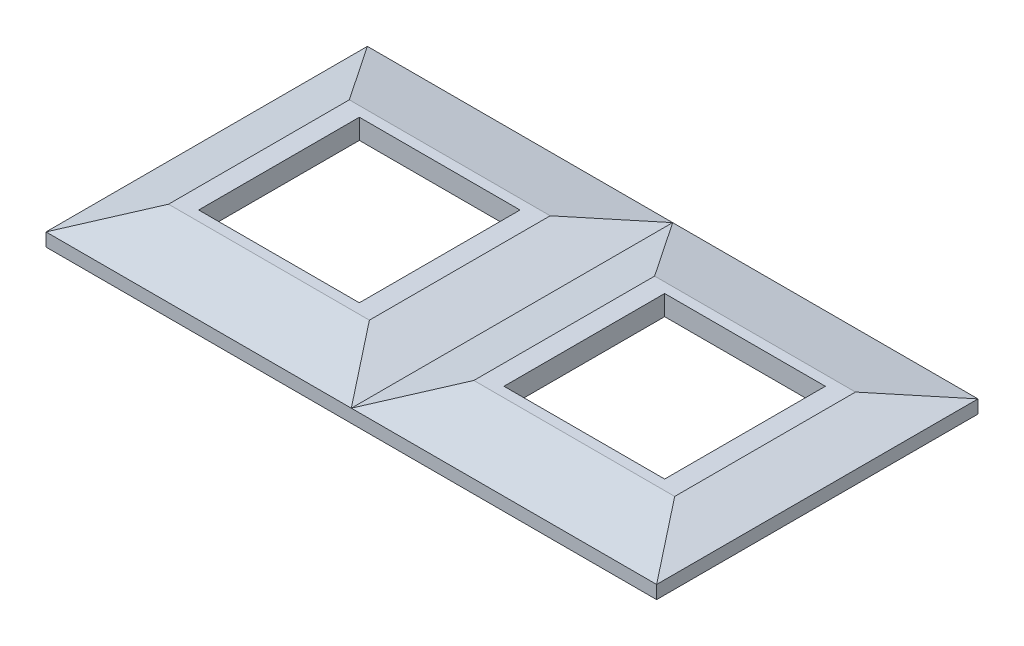
from build123d import *

# Parameters (mm, degrees)
EXTRUDE_1_DEPTH     = 40
SKETCH_2_OUTSIDE_W  = 116.382
SKETCH_2_OUTSIDE_H  = 43.382
CUT_EXTRUDE_1_DEPTH = 78
SKETCH_3_W          = 40
SKETCH_3_H          = 40
CUT_EXTRUDE_2_DEPTH = 87.168439698
SKETCH_4_W          = 71
SKETCH_4_H          = 71
CUT_EXTRUDE_3_DEPTH = 2


with BuildPart() as part:
    # Эскиз1 → Бобышка-Вытянуть1 (new, symmetric)
    with BuildSketch(Plane.XY):
        Polygon((0, 0), (-76, 0), (-76, 3.277823138), (-63, 7), (-13, 7), (0, 3.277823138), (13, 7), (63, 7), (76, 3.277823138), (76, 0), align=None)
    extrude(amount=EXTRUDE_1_DEPTH, both=True)

    # Эскиз2 outside → Вырез-Вытянуть1 (cut, symmetric)
    with BuildSketch(Plane(origin=(0, 0, 0), x_dir=(0, 0, -1), z_dir=(1, 0, 0))):
        with Locations((0, 3.5)):
            Rectangle(SKETCH_2_OUTSIDE_W, SKETCH_2_OUTSIDE_H)
        Polygon((40, 0), (-40, 0), (-40, 3.277823138), (-22.5, 7), (22.5, 7), (40, 3.277823138), align=None, mode=Mode.SUBTRACT)
    extrude(amount=CUT_EXTRUDE_1_DEPTH, both=True, mode=Mode.SUBTRACT)

    # Эскиз3 → Вырез-Вытянуть2 (cut, through all)
    with BuildSketch(Plane.XZ):
        with Locations((-38, 0)):
            Rectangle(SKETCH_3_W, SKETCH_3_H)
        with Locations((38, 0)):
            Rectangle(SKETCH_3_W, SKETCH_3_H)
    extrude(amount=-CUT_EXTRUDE_2_DEPTH, mode=Mode.SUBTRACT)

    # Эскиз4 → Вырез-Вытянуть3 (cut)
    with BuildSketch(Plane.XZ):
        with Locations((-38, 0)):
            Rectangle(SKETCH_4_W, SKETCH_4_H)
        with Locations((38, 0)):
            Rectangle(SKETCH_4_W, SKETCH_4_H)
    extrude(amount=-CUT_EXTRUDE_3_DEPTH, mode=Mode.SUBTRACT)


solid = part.part
